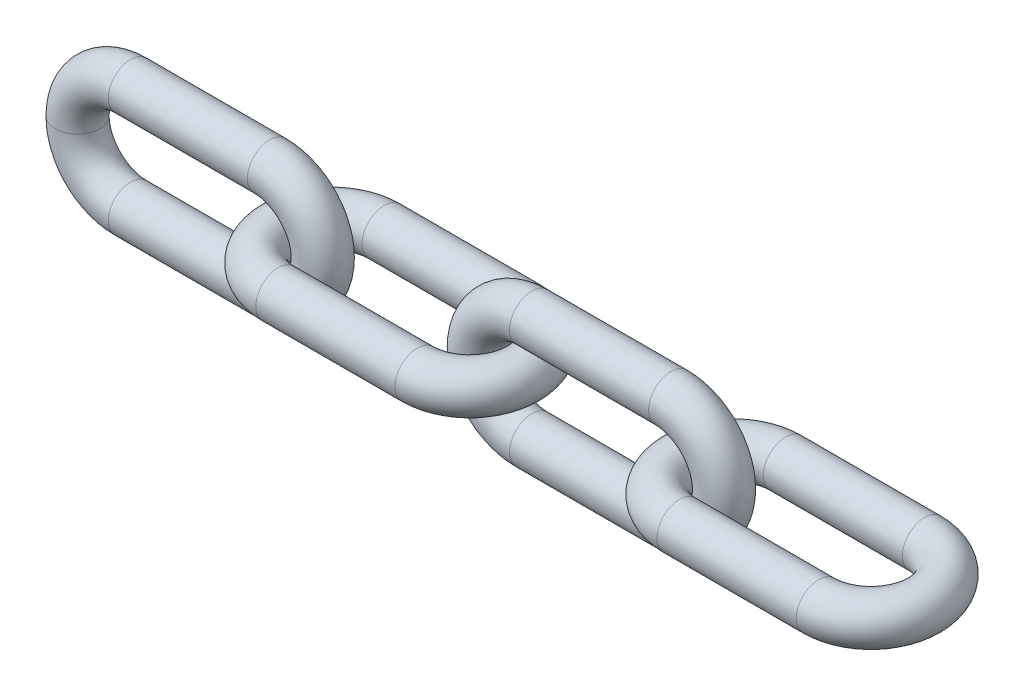
from build123d import *

# Parameters (mm, degrees)
SKETCH2_R             = 3.5052
BODY_MOVE_COPY2_ANGLE = 90.5


with BuildPart() as part:
    # Sweep1: sweep along a path in Sketch1
    with BuildLine(Plane.XY) as sweep1_path:
        Line((-10.922, 4.826), (10.922, 4.826))
        ThreePointArc((10.922, 4.826), (15.748, 0), (10.922, -4.826))
        Line((10.922, -4.826), (-10.922, -4.826))
        ThreePointArc((-10.922, -4.826), (-15.748, 0), (-10.922, 4.826))
    # Sketch2 → Sweep1 (sweep)
    with BuildSketch(Plane(origin=(0, 0, 0), x_dir=(1, 0, 0), z_dir=(0, 1, 0))):
        with Locations((-19.2532, 0)):
            Circle(SKETCH2_R)
    sweep(path=sweep1_path.line)


with BuildPart() as body_2:
    # Body-Move/Copy1: read off the stored shape, not the designer's step
    # Body-Move/Copy1: copy of part
    add(part.part.moved(Location((62.992, 0, 0))))


with BuildPart() as body_3:
    # Body-Move_Copy1 2: copy of part
    add(part.part.moved(Location((94.488, 0, 0))))


with BuildPart() as body_4:
    # Body-Move_Copy1 3: copy of part
    add(part.part.moved(Location((31.496, 0, 0))))


with BuildPart() as body_4_1:
    # Body-Move/Copy2: moved
    add(body_4.part.rotate(Axis((0, 0, 0), (1, 0, 0)), BODY_MOVE_COPY2_ANGLE))


with BuildPart() as body_3_1:
    # Body-Move/Copy2: moved
    add(body_3.part.rotate(Axis((0, 0, 0), (1, 0, 0)), BODY_MOVE_COPY2_ANGLE))


solid = Compound([part.part, body_2.part, body_4_1.part, body_3_1.part])
